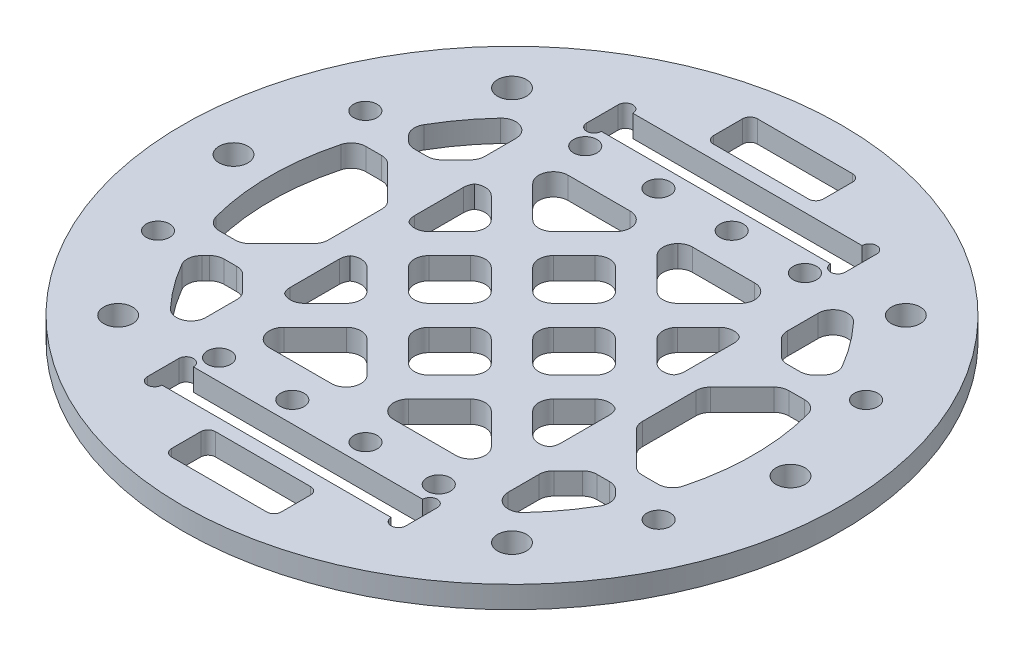
from build123d import *

# Parameters (mm, degrees)
SKETCH_1_R               = 45
EXTRUDE_1_DEPTH          = 3
CUT_EXTRUDE_1_DEPTH      = 64.7102817447859
CUT_EXTRUDE_1_DEPTH_BACK = 64.7102817447859
SKETCH_2_R               = 1.6000000000000019
SKETCH_2_R_2             = 1.6
SKETCH_3_R               = 1.5999999999999979
CUT_EXTRUDE_2_DEPTH      = 64.7102817447859
PATTERN_CIRCULAR_1_COUNT = 8
SKETCH_5_R               = 1.9749999999999976
CUT_EXTRUDE_3_DEPTH      = 64.7102817447859
PATTERN_CIRCULAR_2_COUNT = 8
CUT_EXTRUDE_4_DEPTH      = 64.7102817447859
CUT_EXTRUDE_4_DEPTH_BACK = 64.7102817447859
SKETCH_6_R               = 1.0000000000000018
CUT_EXTRUDE_5_DEPTH      = 64.7102817447859
CUT_EXTRUDE_5_DEPTH_BACK = 64.7102817447859
CUT_EXTRUDE_6_DEPTH      = 64.7102817447859
CUT_EXTRUDE_6_DEPTH_BACK = 64.7102817447859
FILLET_1_R               = 2
CUT_EXTRUDE_7_DEPTH      = 64.7102817447859
CUT_EXTRUDE_7_DEPTH_BACK = 64.7102817447859
FILLET_2_R               = 1


with BuildPart() as part:
    # 草图1 → 凸台-拉伸1 (new body)
    with BuildSketch(Plane(origin=(0, 0, 0), x_dir=(1, 0, 0), z_dir=(0, 1, 0))):
        with Locations(Location((0, 0, 0), (0, 0, 270))):
            Circle(SKETCH_1_R)
    extrude(amount=EXTRUDE_1_DEPTH)

    # 草图2 → 切除-拉伸1 (cut, two sides: drawn at the far end of the back side and taken through both)
    with BuildSketch(Plane(origin=(0, 3, 0), x_dir=(1, 0, 0), z_dir=(0, 1, 0)).offset(-CUT_EXTRUDE_1_DEPTH_BACK)):
        with Locations(Location((-15, 24.99999999999999, 0), (0, 0, 270))):
            Circle(SKETCH_2_R)
        with Locations(Location((-5.000000000000002, 24.999999999999993, 0), (0, 0, 270))):
            Circle(SKETCH_2_R_2)
        with Locations(Location((4.9999999999999964, 24.999999999999996, 0), (0, 0, 270))):
            Circle(SKETCH_2_R_2)
        with Locations(Location((14.999999999999993, 24.999999999999993, 0), (0, 0, 270))):
            Circle(SKETCH_2_R)
        with Locations(Location((14.999999999999993, -24.999999999999993, 0), (0, 0, 270))):
            Circle(SKETCH_2_R)
        with Locations(Location((4.9999999999999964, -24.999999999999996, 0), (0, 0, 270))):
            Circle(SKETCH_2_R_2)
        with Locations(Location((-5.000000000000002, -24.999999999999993, 0), (0, 0, 270))):
            Circle(SKETCH_2_R_2)
        with Locations(Location((-15, -24.99999999999999, 0), (0, 0, 270))):
            Circle(SKETCH_2_R)
        Polygon((-17.64999999999998, 32.15), (-17.649999999999995, 27.850000000000005), (17.65000000000001, 27.849999999999998), (17.65000000000002, 32.14999999999999), align=None)
        Polygon((-17.649999999999988, -32.15), (-17.650000000000006, -27.850000000000005), (17.65, -27.850000000000005), (17.65000000000002, -32.15), align=None)
    extrude(amount=CUT_EXTRUDE_1_DEPTH + CUT_EXTRUDE_1_DEPTH_BACK, mode=Mode.SUBTRACT)

    # 草图3 → 切除-拉伸2 (cut, symmetric)
    with BuildSketch(Plane(origin=(0, 3, 0), x_dir=(1, 0, 0), z_dir=(0, 1, 0))):
        with Locations(Location((34.1835427029176, 14.159286997508344, 0), (0, 0, 270))):
            Circle(SKETCH_3_R)
    cut_extrude_2 = extrude(amount=CUT_EXTRUDE_2_DEPTH, both=True, mode=Mode.SUBTRACT)

    # 阵列(圆周)1: 切除-拉伸2 ×8 about axis, 4 skipped
    pattern_circular_1_axis = Axis((0, 3, 0), (0, 1, 0))
    add([cut_extrude_2.rotate(pattern_circular_1_axis, i * 360 / PATTERN_CIRCULAR_1_COUNT) for i in range(1, PATTERN_CIRCULAR_1_COUNT) if i not in (1, 2, 5, 6)], mode=Mode.SUBTRACT)

    # 草图5 → 切除-拉伸3 (cut, symmetric)
    with BuildSketch(Plane(origin=(0, 3, 0), x_dir=(1, 0, 0), z_dir=(0, 1, 0))):
        with Locations(Location((38.025000000000006, -2.6553e-13, 0), (0, 0, 270))):
            Circle(SKETCH_5_R)
    cut_extrude_3 = extrude(amount=CUT_EXTRUDE_3_DEPTH, both=True, mode=Mode.SUBTRACT)

    # 阵列(圆周)2: 切除-拉伸3 ×8 about axis
    pattern_circular_2_axis = Axis((6e-17, 0, 3.334e-14), (0, 1, 0))
    for i in range(1, PATTERN_CIRCULAR_2_COUNT):
        add(cut_extrude_3.rotate(pattern_circular_2_axis, i * 360 / PATTERN_CIRCULAR_2_COUNT), mode=Mode.SUBTRACT)

    # 草图6 → 切除-拉伸4 (cut, two sides: drawn at the far end of the back side and taken through both)
    with BuildSketch(Plane(origin=(0, 3, 0), x_dir=(1, 0, 0), z_dir=(0, 1, 0)).offset(-CUT_EXTRUDE_4_DEPTH_BACK)):
        with Locations((-16.649999999999995, 27.850000000000005)):
            Circle(SKETCH_6_R)
        with Locations((-16.64999999999998, 32.15)):
            Circle(SKETCH_6_R)
        with Locations((16.65000000000002, 32.14999999999999)):
            Circle(SKETCH_6_R)
        with Locations((16.65000000000001, 27.850000000000005)):
            Circle(SKETCH_6_R)
        with Locations((16.65000000000002, -27.850000000000005)):
            Circle(SKETCH_6_R)
        with Locations((16.650000000000023, -32.15)):
            Circle(SKETCH_6_R)
        with Locations((-16.650000000000006, -27.850000000000005)):
            Circle(SKETCH_6_R)
        with Locations((-16.650000000000006, -32.15)):
            Circle(SKETCH_6_R)
    extrude(amount=CUT_EXTRUDE_4_DEPTH + CUT_EXTRUDE_4_DEPTH_BACK, mode=Mode.SUBTRACT)

    # 草图7 → 切除-拉伸5 (cut, two sides: drawn at the far end of the back side and taken through both)
    with BuildSketch(Plane(origin=(0, 3, 0), x_dir=(1, 0, 0), z_dir=(0, 1, 0)).offset(-CUT_EXTRUDE_5_DEPTH_BACK)):
        with BuildLine():
            Line((-21.44837043366389, 4.4778076851867485), (-26.970562748477143, 10.000000000000004))
            Line((-26.970562748477143, 10.000000000000004), (-31.448370433663893, 10.000000000000004))
            ThreePointArc((-31.448370391314782, 9.999999986533782), (-33, 4.04e-15), (-31.44837039131479, -9.99999998653376))
            Line((-31.448370433663893, -9.999999999999996), (-26.970562748476787, -9.999999999999996))
            Line((-26.970562748476787, -9.999999999999995), (-21.44837043366389, -4.477807685187097))
            Line((-21.44837043366389, -4.4778076851871), (-21.44837043366389, 4.477807685186752))
        make_face()
        with BuildLine():
            Line((26.970562748477136, 10.000000000000007), (21.448370433663868, 4.47780768518674))
            Line((21.448370433663868, 4.47780768518674), (21.448370433663868, -4.477807685187084))
            Line((21.448370433663875, -4.477807685187091), (26.970562748476787, -10.000000000000004))
            Line((26.970562748476784, -10), (31.44837043366387, -10))
            ThreePointArc((31.448370391314786, -9.999999986533775), (33, 3.55e-15), (31.44837039131479, 9.99999998653378))
            Line((31.44837043366387, 10.000000000000002), (26.970562748477132, 10.000000000000004))
        make_face()
    extrude(amount=CUT_EXTRUDE_5_DEPTH + CUT_EXTRUDE_5_DEPTH_BACK, mode=Mode.SUBTRACT)

    # 草图7<3> → 切除-拉伸6 (cut, two sides: drawn at the far end of the back side and taken through both)
    with BuildSketch(Plane(origin=(0, 3, 0), x_dir=(1, 0, 0), z_dir=(0, 1, 0)).offset(-CUT_EXTRUDE_6_DEPTH_BACK)):
        Polygon((-3.429437251523204, 20.399999999999988), (-17.571572875253793, 20.399999999999988), (-8.48528137423846, 11.313708498984653), (-1.4142135623731207, 18.3847763108499), align=None)
        Polygon((-16.970562748480017, 2.8284271247432065), (-11.313708498984662, 8.485281374238488), (-16.970562748477203, 14.14213562373103), (-18.44837043366389, 12.664327938544487), (-18.448370433663893, 4.306234809927718), align=None)
        Polygon((17.571572875253793, 20.399999999999988), (3.429437251523197, 20.399999999999988), (1.41421356237327, 18.38477631085006), (8.485281374238536, 11.313708498984736), align=None)
        Polygon((-3.55e-15, 14.142135623731296), (-5.656854249492522, 8.485281374238713), (0, 2.8284271247461916), (5.656854249492495, 8.485281374238689), align=None)
        Polygon((-2.828427124746181, 7.11e-15), (-8.485281374238685, 5.656854249492511), (-14.142135623734568, -3.43192e-12), (-8.485281374243293, -5.656854249497091), align=None)
        with BuildLine():
            Line((-20.649999999999995, 16.11955262170047), (-20.649999999999995, 17.82157287525382))
            Line((-20.649999999999995, 17.82157287525382), (-20.649999999999988, 25.740580801528235))
            ThreePointArc((-20.649999999999928, 25.740580801528218), (-25.532625064446698, 20.906579283048394), (-29.30842376980283, 15.16628814607109))
            Line((-29.30842376980275, 15.166288146071132), (-27.142135623732543, 13.00000000000001))
            Line((-27.142135623732543, 13.000000000000005), (-23.769552621700456, 13.000000000000005))
            Line((-23.769552621700456, 13.000000000000002), (-20.649999999999995, 16.11955262170047))
        make_face()
        Polygon((8.485281374238651, 5.656854249492474), (2.828427124746181, 3.55e-15), (8.485281374248604, -5.656854249502413), (14.14213562373895, -7.92788e-12), align=None)
        Polygon((16.9705627484772, 14.142135623731022), (11.313708498984717, 8.48528137423854), (16.970562748484017, 2.828427124739207), (18.44837043366387, 4.30623480992014), (18.44837043366387, 12.664327938544487), align=None)
        Polygon((5.656854249503461, -8.485281374249634), (1.066e-14, -2.8284271247461845), (-5.6568542494976946, -8.485281374243872), (6.62936e-12, -14.142135623750583), align=None)
        Polygon((-11.313708498984692, -8.485281374238491), (-16.970562748477114, -2.8284271247460104), (-18.448370433663893, -4.306234809932805), (-18.448370433663893, -12.664327938544487), (-16.97056274847721, -14.142135623731022), align=None)
        with BuildLine():
            ThreePointArc((29.3084237698043, 15.166288146068254), (25.53262506444785, 20.906579283046984), (20.65000000000026, 25.740580801527944))
            Line((20.65000000000002, 25.740580801527866), (20.65000000000002, 17.821572875253842))
            Line((20.65000000000002, 17.821572875253842), (20.65000000000002, 16.119552621700446))
            Line((20.65000000000002, 16.119552621700446), (23.769552621700456, 13.000000000000002))
            Line((23.769552621700456, 13.000000000000002), (27.142135623737385, 13.000000000000002))
            Line((27.142135623737385, 13.000000000000005), (29.308423769804147, 15.166288146068348))
        make_face()
        Polygon((16.97056274847706, -2.8284271247460886), (11.313708498984695, -8.485281374238504), (16.970562748477207, -14.142135623731019), (18.448370433663868, -12.664327938544485), (18.44837043366387, -4.3062348099329295), align=None)
        Polygon((-1.4142135623730816, -18.384776310850203), (-8.485281374238523, -11.31370849898469), (-17.57157287525382, -20.4), (-3.4294372515228666, -20.399999999999995), align=None)
        Polygon((17.57157287525382, -20.399999999999995), (8.485281374238529, -11.313708498984703), (1.414213562373075, -18.384776310850214), (3.429437251522856, -20.399999999999995), align=None)
        with BuildLine():
            Line((-23.769552621700456, -12.999999999999998), (-27.142135623730987, -13))
            Line((-27.142135623730987, -13), (-29.308423769802527, -15.166288146071564))
            ThreePointArc((-29.308423769802612, -15.166288146071512), (-25.53262506444661, -20.9065792830485), (-20.65000000000006, -25.74058080152811))
            Line((-20.650000000000034, -25.740580801528093), (-20.64999999999999, -17.821572875253803))
            Line((-20.649999999999988, -17.821572875253803), (-20.649999999999988, -16.11955262170048))
            Line((-20.649999999999988, -16.11955262170048), (-23.769552621700456, -13.000000000000002))
        make_face()
        with BuildLine():
            Line((20.65000000000002, -17.821572875253832), (20.650000000000055, -25.740580801528083))
            ThreePointArc((20.650000000000073, -25.7405808015281), (25.532625064446584, -20.906579283048536), (29.308423769802573, -15.166288146071587))
            Line((29.308423769802403, -15.166288146071674), (27.142135623730763, -12.999999999999995))
            Line((27.142135623730766, -13.000000000000002), (23.769552621700456, -13.000000000000002))
            Line((23.769552621700456, -13.000000000000002), (20.65000000000002, -16.119552621700446))
            Line((20.65000000000002, -16.119552621700446), (20.65000000000002, -17.821572875253832))
        make_face()
    extrude(amount=CUT_EXTRUDE_6_DEPTH + CUT_EXTRUDE_6_DEPTH_BACK, mode=Mode.SUBTRACT)

    # 圆角1
    # the kernel refuses this fillet: 2 mm, written as the material it adds along each edge
    with BuildSketch(Plane(origin=(-8.485281374243288, 3, 5.656854249497091), x_dir=(-0.7071067811863999, 0, -0.7071067811866952), z_dir=(0, -1, 0))) as fillet_1_piece_1:
        with BuildLine():
            CenterArc((FILLET_1_R, FILLET_1_R), FILLET_1_R, 179.9999999999879, 90.00000000001216)
            Line((4.1756e-13, FILLET_1_R), (0, 0))
            Line((0, 0), (FILLET_1_R, -3e-17))
        make_face()
    extrude(amount=3)
    with BuildSketch(Plane(origin=(-14.14213562373457, 3, 3.43015e-12), x_dir=(0.7071067811865441, 0, -0.7071067811865508), z_dir=(0, -1, 0))) as fillet_1_piece_2:
        with BuildLine():
            CenterArc((FILLET_1_R, FILLET_1_R), FILLET_1_R, 180.0000000000123, 89.99999999998761)
            Line((-4.3256e-13, FILLET_1_R), (0, 0))
            Line((0, 0), (FILLET_1_R, 0))
        make_face()
    extrude(amount=3)
    with BuildSketch(Plane(origin=(-8.485281374238687, 0, -5.656854249492511), x_dir=(0.707106781186548, 0, 0.7071067811865471), z_dir=(0, 1, 0))) as fillet_1_piece_3:
        with BuildLine():
            CenterArc((FILLET_1_R, -FILLET_1_R), FILLET_1_R, 89.99999999999997, 90.00000000000045)
            Line((9.47e-15, -FILLET_1_R), (0, 0))
            Line((0, 0), (FILLET_1_R, -8e-17))
        make_face()
    extrude(amount=3)
    with BuildSketch(Plane(origin=(-2.8284271247461827, 0, -8.88e-15), x_dir=(-0.7071067811865476, 0, -0.7071067811865475), z_dir=(0, 1, 0))) as fillet_1_piece_4:
        with BuildLine():
            CenterArc((FILLET_1_R, FILLET_1_R), FILLET_1_R, 180.00000000000006, 89.99999999999994)
            Line((-4.2e-16, FILLET_1_R), (0, 0))
            Line((0, 0), (FILLET_1_R, -4e-17))
        make_face()
    extrude(amount=3)
    with BuildSketch(Plane(origin=(-16.970562748477203, 3, -14.14213562373103), x_dir=(0.7071067811865476, 0, 0.7071067811865476), z_dir=(0, -1, 0))) as fillet_1_piece_5:
        with BuildLine():
            CenterArc((FILLET_1_R, FILLET_1_R), FILLET_1_R, 180.0000000000028, 89.99999999999716)
            Line((-9.803e-14, FILLET_1_R), (0, 0))
            Line((0, 0), (FILLET_1_R, -1e-17))
        make_face()
    extrude(amount=3)
    with BuildSketch(Plane(origin=(-11.313708498984662, 0, -8.485281374238488), x_dir=(-0.7071067811865521, 0, 0.7071067811865432), z_dir=(0, 1, 0))) as fillet_1_piece_6:
        with BuildLine():
            CenterArc((FILLET_1_R, -FILLET_1_R), FILLET_1_R, 89.99999999999996, 90.0000000000004)
            Line((1.256e-14, -FILLET_1_R), (0, 0))
            Line((0, 0), (FILLET_1_R, -6e-17))
        make_face()
    extrude(amount=3)
    with BuildSketch(Plane(origin=(-16.97056274848002, 0, -2.8284271247432087), x_dir=(0.7071067811865535, 0, -0.7071067811865417), z_dir=(0, 1, 0))) as fillet_1_piece_7:
        with BuildLine():
            CenterArc((FILLET_1_R, FILLET_1_R), FILLET_1_R, 179.99999999998835, 90.00000000001177)
            Line((4.0452e-13, FILLET_1_R), (0, 0))
            Line((0, 0), (FILLET_1_R, 6e-17))
        make_face()
    extrude(amount=3)
    with BuildSketch(Plane(origin=(-18.448370433663897, 3, -4.306234809927716), x_dir=(4.29e-15, 0, -1), z_dir=(0, -1, 0))) as fillet_1_piece_8:
        with BuildLine():
            CenterArc((FILLET_1_R * 0.414213562373, FILLET_1_R), FILLET_1_R, 225.00000000001185, 44.99999999998789)
            Line((-FILLET_1_R * 0.292893218813, FILLET_1_R * 0.292893218813), (0, 0))
            Line((0, 0), (FILLET_1_R * 0.414213562373, 0))
        make_face()
    extrude(amount=3)
    with BuildSketch(Plane(origin=(-18.44837043366389, 3, -12.664327938544487), x_dir=(0.7071067811865819, 0, -0.7071067811865133), z_dir=(0, -1, 0))) as fillet_1_piece_9:
        with BuildLine():
            CenterArc((FILLET_1_R * 0.414213562373, FILLET_1_R), FILLET_1_R, 224.99999999999721, 45.00000000000284)
            Line((-FILLET_1_R * 0.292893218813, FILLET_1_R * 0.292893218813), (0, 0))
            Line((0, 0), (FILLET_1_R * 0.414213562373, 0))
        make_face()
    extrude(amount=3)
    with BuildSketch(Plane(origin=(0, 0, -2.8284271247461916), x_dir=(-0.7071067811865474, 0, -0.7071067811865478), z_dir=(0, 1, 0))) as fillet_1_piece_10:
        with BuildLine():
            CenterArc((FILLET_1_R, -FILLET_1_R), FILLET_1_R, 90.00000000000001, 90)
            Line((7e-16, -FILLET_1_R), (0, 0))
            Line((0, 0), (FILLET_1_R, -7e-17))
        make_face()
    extrude(amount=3)
    with BuildSketch(Plane(origin=(-5.656854249492521, 0, -8.485281374238713), x_dir=(0.7071067811865476, 0, 0.7071067811865476), z_dir=(0, 1, 0))) as fillet_1_piece_11:
        with BuildLine():
            CenterArc((FILLET_1_R, FILLET_1_R), FILLET_1_R, 180.00000000000037, 89.9999999999996)
            Line((-1.009e-14, FILLET_1_R), (0, 0))
            Line((0, 0), (FILLET_1_R, 1e-17))
        make_face()
    extrude(amount=3)
    with BuildSketch(Plane(origin=(-1.78e-15, 3, -14.142135623731296), x_dir=(0.7071067811865411, 0, 0.707106781186554), z_dir=(0, -1, 0))) as fillet_1_piece_12:
        with BuildLine():
            CenterArc((FILLET_1_R, FILLET_1_R), FILLET_1_R, 179.9999999999991, 90.00000000000097)
            Line((2.737e-14, FILLET_1_R), (0, 0))
            Line((0, 0), (FILLET_1_R, -1e-16))
        make_face()
    extrude(amount=3)
    with BuildSketch(Plane(origin=(5.656854249492495, 3, -8.485281374238689), x_dir=(-0.7071067811865474, 0, 0.7071067811865478), z_dir=(0, -1, 0))) as fillet_1_piece_13:
        with BuildLine():
            CenterArc((FILLET_1_R, FILLET_1_R), FILLET_1_R, 180.00000000000057, 89.99999999999943)
            Line((-2.068e-14, FILLET_1_R), (0, 0))
            Line((0, 0), (FILLET_1_R, -2e-17))
        make_face()
    extrude(amount=3)
    with BuildSketch(Plane(origin=(-17.57157287525382, 0, 20.4), x_dir=(1, 0, -7.4e-16), z_dir=(0, 1, 0))) as fillet_1_piece_14:
        with BuildLine():
            CenterArc((FILLET_1_R * 2.41421356237, FILLET_1_R), FILLET_1_R, 134.99999999999997, 134.99999999999997)
            Line((FILLET_1_R * 1.70710678119, FILLET_1_R * 1.70710678119), (0, 0))
            Line((0, 0), (FILLET_1_R * 2.41421356237, 0))
        make_face()
    extrude(amount=3)
    with BuildSketch(Plane(origin=(-8.485281374238522, 3, 11.313708498984695), x_dir=(0.7071067811865446, 0, 0.7071067811865503), z_dir=(0, -1, 0))) as fillet_1_piece_15:
        with BuildLine():
            CenterArc((FILLET_1_R, FILLET_1_R), FILLET_1_R, 179.9999999999997, 90.00000000000034)
            Line((8.23e-15, FILLET_1_R), (0, 0))
            Line((0, 0), (FILLET_1_R, 5e-17))
        make_face()
    extrude(amount=3)
    with BuildSketch(Plane(origin=(-18.448370433663893, 0, 4.306234809932805), x_dir=(0.7071067811865437, 0, -0.7071067811865512), z_dir=(0, 1, 0))) as fillet_1_piece_16:
        with BuildLine():
            CenterArc((FILLET_1_R * 0.414213562373, -FILLET_1_R), FILLET_1_R, 90, 44.99999999999969)
            Line((-FILLET_1_R * 0.292893218813, -FILLET_1_R * 0.292893218813), (0, 0))
            Line((0, 0), (FILLET_1_R * 0.414213562373, -1e-17))
        make_face()
    extrude(amount=3)
    with BuildSketch(Plane(origin=(-16.970562748477114, 0, 2.8284271247460113), x_dir=(-0.7071067811865436, 0, 0.7071067811865516), z_dir=(0, 1, 0))) as fillet_1_piece_17:
        with BuildLine():
            CenterArc((FILLET_1_R, FILLET_1_R), FILLET_1_R, 179.99999999999943, 90.00000000000057)
            Line((2.318e-14, FILLET_1_R), (0, 0))
            Line((0, 0), (FILLET_1_R, -4e-17))
        make_face()
    extrude(amount=3)
    with BuildSketch(Plane(origin=(-11.313708498984688, 3, 8.485281374238493), x_dir=(-0.7071067811865462, 0, 0.7071067811865489), z_dir=(0, -1, 0))) as fillet_1_piece_18:
        with BuildLine():
            CenterArc((FILLET_1_R, FILLET_1_R), FILLET_1_R, 180.00000000000028, 89.99999999999977)
            Line((-1.256e-14, FILLET_1_R), (0, 0))
            Line((0, 0), (FILLET_1_R, 5e-17))
        make_face()
    extrude(amount=3)
    with BuildSketch(Plane(origin=(-16.970562748477207, 3, 14.14213562373102), x_dir=(-0.707106781186584, 0, -0.7071067811865112), z_dir=(0, -1, 0))) as fillet_1_piece_19:
        with BuildLine():
            CenterArc((FILLET_1_R, FILLET_1_R), FILLET_1_R, 180.0000000000027, 89.99999999999739)
            Line((-1.0047e-13, FILLET_1_R), (0, 0))
            Line((0, 0), (FILLET_1_R, 3e-17))
        make_face()
    extrude(amount=3)
    with BuildSketch(Plane(origin=(-18.44837043366389, 3, 12.664327938544487), x_dir=(-4.29e-15, 0, -1), z_dir=(0, -1, 0))) as fillet_1_piece_20:
        with BuildLine():
            CenterArc((FILLET_1_R * 0.414213562373, FILLET_1_R), FILLET_1_R, 224.99999999999736, 45.0000000000029)
            Line((-FILLET_1_R * 0.292893218813, FILLET_1_R * 0.292893218813), (0, 0))
            Line((0, 0), (FILLET_1_R * 0.414213562373, 0))
        make_face()
    extrude(amount=3)
    with BuildSketch(Plane(origin=(16.970562748477207, 0, 14.142135623731017), x_dir=(-0.7071067811865479, 0, -0.707106781186547), z_dir=(0, 1, 0))) as fillet_1_piece_21:
        with BuildLine():
            CenterArc((FILLET_1_R, -FILLET_1_R), FILLET_1_R, 89.99999999999993, 89.99999999999751)
            Line((-9.298e-14, -FILLET_1_R), (0, 0))
            Line((0, 0), (FILLET_1_R, -1e-17))
        make_face()
    extrude(amount=3)
    with BuildSketch(Plane(origin=(11.313708498984695, 0, 8.485281374238504), x_dir=(0.7071067811865471, 0, 0.707106781186548), z_dir=(0, 1, 0))) as fillet_1_piece_22:
        with BuildLine():
            CenterArc((FILLET_1_R, FILLET_1_R), FILLET_1_R, 180.00000000000026, 89.99999999999972)
            Line((-1.071e-14, FILLET_1_R), (0, 0))
            Line((0, 0), (FILLET_1_R, 5e-17))
        make_face()
    extrude(amount=3)
    with BuildSketch(Plane(origin=(16.970562748477057, 3, 2.8284271247460895), x_dir=(0.7071067811865401, 0, 0.7071067811865552), z_dir=(0, -1, 0))) as fillet_1_piece_23:
        with BuildLine():
            CenterArc((FILLET_1_R, FILLET_1_R), FILLET_1_R, 179.99999999999915, 90.00000000000085)
            Line((2.769e-14, FILLET_1_R), (0, 0))
            Line((0, 0), (FILLET_1_R, -4e-17))
        make_face()
    extrude(amount=3)
    with BuildSketch(Plane(origin=(18.448370433663868, 3, 4.3062348099329295), x_dir=(4.29e-15, 0, 1), z_dir=(0, -1, 0))) as fillet_1_piece_24:
        with BuildLine():
            CenterArc((FILLET_1_R * 0.414213562373, FILLET_1_R), FILLET_1_R, 225.00000000000074, 44.99999999999949)
            Line((-FILLET_1_R * 0.292893218813, FILLET_1_R * 0.292893218813), (0, 0))
            Line((0, 0), (FILLET_1_R * 0.414213562373, 0))
        make_face()
    extrude(amount=3)
    with BuildSketch(Plane(origin=(18.448370433663868, 3, 12.664327938544485), x_dir=(-0.7071067811865797, 0, 0.7071067811865154), z_dir=(0, -1, 0))) as fillet_1_piece_25:
        with BuildLine():
            CenterArc((FILLET_1_R * 0.414213562373, FILLET_1_R), FILLET_1_R, 224.99999999999744, 45.0000000000025)
            Line((-FILLET_1_R * 0.292893218813, FILLET_1_R * 0.292893218813), (0, 0))
            Line((0, 0), (FILLET_1_R * 0.414213562373, 3e-17))
        make_face()
    extrude(amount=3)
    with BuildSketch(Plane(origin=(-20.649999999999995, 0, -16.11955262170047), x_dir=(0, 0, -1), z_dir=(0, 1, 0))) as fillet_1_piece_26:
        with BuildLine():
            CenterArc((FILLET_1_R * 0.414213562373, FILLET_1_R), FILLET_1_R, 225.00000000000003, 45)
            Line((-FILLET_1_R * 0.292893218813, FILLET_1_R * 0.292893218813), (0, 0))
            Line((0, 0), (FILLET_1_R * 0.414213562373, 0))
        make_face()
    extrude(amount=3)
    with BuildSketch(Plane(origin=(-23.769552621700456, 3, -13.000000000000004), x_dir=(-1, 0, -2.14e-15), z_dir=(0, -1, 0))) as fillet_1_piece_27:
        with BuildLine():
            CenterArc((FILLET_1_R * 0.414213562373, FILLET_1_R), FILLET_1_R, 224.9999999999999, 45)
            Line((-FILLET_1_R * 0.292893218813, FILLET_1_R * 0.292893218813), (0, 0))
            Line((0, 0), (FILLET_1_R * 0.414213562373, 0))
        make_face()
    extrude(amount=3)
    with BuildSketch(Plane(origin=(-27.142135623732543, 3, -13.000000000000007), x_dir=(-0.7071067811863953, 0, -0.7071067811866998), z_dir=(0, -1, 0))) as fillet_1_piece_28:
        with BuildLine():
            CenterArc((FILLET_1_R * 0.414213562373, FILLET_1_R), FILLET_1_R, 224.99999999998775, 45.000000000011994)
            Line((-FILLET_1_R * 0.292893218813, FILLET_1_R * 0.292893218814), (0, 0))
            Line((0, 0), (FILLET_1_R * 0.414213562373, -4e-17))
        make_face()
    extrude(amount=3)
    with BuildSketch(Plane(origin=(-29.308423769802793, 3, -15.16628814607111), x_dir=(0.48026215463850636, 0, -0.8771249984021545), z_dir=(0, -1, 0))) as fillet_1_piece_29:
        with BuildLine():
            CenterArc((1.499144306143534, 1.999451234858091), FILLET_1_R, 196.2974748554541, 75.04475168334295)
            Line((-0.4204910150774538, 1.438202418805179), (0, 0))
            ThreePointArc((0, 0), (0.7729962828552733, -0.0090546248415106), (1.5459925657105555, 8e-17))
        make_face()
    extrude(amount=3)
    with BuildSketch(Plane(origin=(-31.44837041248934, 0, 9.999999993266874), x_dir=(-0.2806243940298316, 0, -0.9598176647027236), z_dir=(0, 1, 0))) as fillet_1_piece_30:
        with BuildLine():
            CenterArc((1.4991443216942395, -1.9994512355412468), FILLET_1_R, 88.65777429671002, 75.04475168335676)
            Line((-0.4204910077112095, -1.4382024474815904), (0, 0))
            ThreePointArc((0, 0), (0.7729962759221107, 0.00905461356940789), (1.545992552104564, 3e-17))
        make_face()
    extrude(amount=3)
    with BuildSketch(Plane(origin=(-31.448370412489332, 0, -9.999999993266892), x_dir=(1.0, 0, -4.493497901417946e-09), z_dir=(0, 1, 0))) as fillet_1_piece_31:
        with BuildLine():
            CenterArc((1.49841213975847, -2), FILLET_1_R, 89.99999974254155, 75.04475168335657)
            ThreePointArc((-0.4338432297767472, -1.4838709590593469), (-0.2256123928914084, -0.7393945339195913), (0, 0))
            Line((0, 0), (1.4984121487454658, 0))
        make_face()
    extrude(amount=3)
    with BuildSketch(Plane(origin=(31.448370412489332, 0, -9.99999999326689), x_dir=(-1.0, 0, -4.493497901417989e-09), z_dir=(0, 1, 0))) as fillet_1_piece_32:
        with BuildLine():
            CenterArc((1.4984121397584558, 2), FILLET_1_R, 194.95524857410172, 75.04475168335671)
            ThreePointArc((-0.433843229776765, 1.4838709590593522), (-0.2256123928914226, 0.7393945339195931), (0, 0))
            Line((0, 0), (1.4984121487454516, 0))
        make_face()
    extrude(amount=3)
    with BuildSketch(Plane(origin=(31.448370412489332, 3, 9.999999993266888), x_dir=(0.28062439402983425, 0, -0.9598176647027227), z_dir=(0, -1, 0))) as fillet_1_piece_33:
        with BuildLine():
            CenterArc((1.4991443216942513, -1.9994512355412484), FILLET_1_R, 88.65777429670968, 75.04475168335676)
            Line((-0.4204910077111942, -1.4382024474815798), (0, 0))
            ThreePointArc((0, 0), (0.7729962759221258, 0.00905461356941978), (1.5459925521045874, -2e-17))
        make_face()
    extrude(amount=3)
    with BuildSketch(Plane(origin=(17.57157287525382, 0, 20.399999999999995), x_dir=(-1, 0, 0), z_dir=(0, 1, 0))) as fillet_1_piece_34:
        with BuildLine():
            CenterArc((FILLET_1_R * 2.41421356237, -FILLET_1_R), FILLET_1_R, 90, 135.00000000000003)
            Line((FILLET_1_R * 1.70710678119, -FILLET_1_R * 1.70710678119), (0, 0))
            Line((0, 0), (FILLET_1_R * 2.41421356237, 0))
        make_face()
    extrude(amount=3)
    with BuildSketch(Plane(origin=(8.485281374238527, 3, 11.3137084989847), x_dir=(0.7071067811865477, 0, 0.7071067811865477), z_dir=(0, -1, 0))) as fillet_1_piece_35:
        with BuildLine():
            CenterArc((FILLET_1_R, FILLET_1_R), FILLET_1_R, 179.99999999999974, 90.00000000000023)
            Line((6.3e-15, FILLET_1_R), (0, 0))
            Line((0, 0), (FILLET_1_R, -5e-17))
        make_face()
    extrude(amount=3)
    with BuildSketch(Plane(origin=(5.656854249503457, 3, 8.485281374249631), x_dir=(-0.7071067811862916, 0, 0.7071067811868036), z_dir=(0, -1, 0))) as fillet_1_piece_36:
        with BuildLine():
            CenterArc((FILLET_1_R, FILLET_1_R), FILLET_1_R, 180.00000000002092, 89.99999999997891)
            Line((-7.266e-13, FILLET_1_R), (0, 0))
            Line((0, 0), (FILLET_1_R, 0))
        make_face()
    extrude(amount=3)
    with BuildSketch(Plane(origin=(6.62974e-12, 0, 14.142135623750583), x_dir=(-0.7071067811863985, 0, -0.7071067811866967), z_dir=(0, 1, 0))) as fillet_1_piece_37:
        with BuildLine():
            CenterArc((FILLET_1_R, -FILLET_1_R), FILLET_1_R, 90.00000000000001, 90.00000000003303)
            Line((1.15308e-12, -FILLET_1_R), (0, 0))
            Line((0, 0), (FILLET_1_R, -6e-17))
        make_face()
    extrude(amount=3)
    with BuildSketch(Plane(origin=(-5.656854249497698, 0, 8.48528137424387), x_dir=(0.7071067811863981, 0, 0.707106781186697), z_dir=(0, 1, 0))) as fillet_1_piece_38:
        with BuildLine():
            CenterArc((FILLET_1_R, FILLET_1_R), FILLET_1_R, 180.00000000001208, 89.99999999998795)
            Line((-4.2262e-13, FILLET_1_R), (0, 0))
            Line((0, 0), (FILLET_1_R, 1e-17))
        make_face()
    extrude(amount=3)
    with BuildSketch(Plane(origin=(7.11e-15, 3, 2.828427124746179), x_dir=(0.707106781186547, 0, 0.7071067811865479), z_dir=(0, -1, 0))) as fillet_1_piece_39:
        with BuildLine():
            CenterArc((FILLET_1_R, FILLET_1_R), FILLET_1_R, 180, 89.99999999999994)
            Line((-1.47e-15, FILLET_1_R), (0, 0))
            Line((0, 0), (FILLET_1_R, 1e-17))
        make_face()
    extrude(amount=3)
    with BuildSketch(Plane(origin=(20.65000000000002, 3, 16.119552621700446), x_dir=(0.7071067811865465, 0, -0.7071067811865486), z_dir=(0, -1, 0))) as fillet_1_piece_40:
        with BuildLine():
            CenterArc((FILLET_1_R * 0.414213562373, FILLET_1_R), FILLET_1_R, 224.99999999999977, 45.000000000000284)
            Line((-FILLET_1_R * 0.292893218813, FILLET_1_R * 0.292893218813), (0, 0))
            Line((0, 0), (FILLET_1_R * 0.414213562373, -1e-17))
        make_face()
    extrude(amount=3)
    with BuildSketch(Plane(origin=(23.769552621700456, 3, 13.000000000000002), x_dir=(1, 0, 0), z_dir=(0, -1, 0)), Plane(origin=(-26.970562748476787, 3, 9.999999999999996), x_dir=(-1, 0, 0), z_dir=(0, -1, 0))) as fillet_1_piece_41:
        with BuildLine():
            CenterArc((FILLET_1_R * 0.414213562373, FILLET_1_R), FILLET_1_R, 224.99999999999994, 45.00000000000006)
            Line((-FILLET_1_R * 0.292893218813, FILLET_1_R * 0.292893218813), (0, 0))
            Line((0, 0), (FILLET_1_R * 0.414213562373, 0))
        make_face()
    extrude(amount=3)
    with BuildSketch(Plane(origin=(27.142135623730766, 0, 12.999999999999998), x_dir=(0.7071067811865432, 0, 0.7071067811865518), z_dir=(0, 1, 0))) as fillet_1_piece_42:
        with BuildLine():
            CenterArc((FILLET_1_R * 0.414213562373, -FILLET_1_R), FILLET_1_R, 89.99999999999989, 45.00000000000057)
            Line((-FILLET_1_R * 0.292893218813, -FILLET_1_R * 0.292893218813), (0, 0))
            Line((0, 0), (FILLET_1_R * 0.414213562373, -1e-17))
        make_face()
    extrude(amount=3)
    with BuildSketch(Plane(origin=(29.30842376980249, 0, 15.16628814607163), x_dir=(-0.48026215463851096, 0, 0.877124998402152), z_dir=(0, 1, 0))) as fillet_1_piece_43:
        with BuildLine():
            CenterArc((1.4991443061439038, -1.9994512348580888), FILLET_1_R, 88.65777346120144, 75.04475168335644)
            Line((-0.4204910150772023, -1.4382024188055782), (0, 0))
            ThreePointArc((0, 0), (0.7729962828554874, 0.0090546248415306), (1.5459925657109772, 6e-17))
        make_face()
    extrude(amount=3)
    with BuildSketch(Plane(origin=(20.650000000000066, 0, 25.740580801528093), x_dir=(0.7332653110766536, 0, -0.6799426325592908), z_dir=(0, 1, 0))) as fillet_1_piece_44:
        with BuildLine():
            CenterArc((4.5773374061833865, 1.9948782030954904), FILLET_1_R, 137.16083968785634, 136.94050749824711)
            Line((3.11080678403007, 3.3547634682140615), (0, 0))
            ThreePointArc((0, 0), (2.3601896000633174, -0.08450964892437705), (4.720379200126623, 2.2e-16))
        make_face()
    extrude(amount=3)
    with BuildSketch(Plane(origin=(-27.142135623730987, 0, 13), x_dir=(-0.7071067811865432, 0, 0.7071067811865518), z_dir=(0, 1, 0))) as fillet_1_piece_45:
        with BuildLine():
            CenterArc((FILLET_1_R * 0.414213562373, FILLET_1_R), FILLET_1_R, 224.99999999999974, 45.00000000000023)
            Line((-FILLET_1_R * 0.292893218813, FILLET_1_R * 0.292893218813), (0, 0))
            Line((0, 0), (FILLET_1_R * 0.414213562373, -1e-17))
        make_face()
    extrude(amount=3)
    with BuildSketch(Plane(origin=(-23.769552621700456, 3, 13), x_dir=(0.7071067811865465, 0, 0.7071067811865486), z_dir=(0, -1, 0))) as fillet_1_piece_46:
        with BuildLine():
            CenterArc((FILLET_1_R * 0.414213562373, FILLET_1_R), FILLET_1_R, 224.9999999999999, 45.00000000000006)
            Line((-FILLET_1_R * 0.292893218813, FILLET_1_R * 0.292893218813), (0, 0))
            Line((0, 0), (FILLET_1_R * 0.414213562373, 0))
        make_face()
    extrude(amount=3)
    with BuildSketch(Plane(origin=(-20.649999999999988, 3, 16.11955262170048), x_dir=(0, 0, 1), z_dir=(0, -1, 0))) as fillet_1_piece_47:
        with BuildLine():
            CenterArc((FILLET_1_R * 0.414213562373, FILLET_1_R), FILLET_1_R, 224.9999999999999, 45.000000000000455)
            Line((-FILLET_1_R * 0.292893218813, FILLET_1_R * 0.292893218813), (0, 0))
            Line((0, 0), (FILLET_1_R * 0.414213562373, 0))
        make_face()
    extrude(amount=3)
    with BuildSketch(Plane(origin=(-20.65000000000005, 3, 25.740580801528104), x_dir=(-0.733265311076655, 0, -0.679942632559289), z_dir=(0, -1, 0))) as fillet_1_piece_48:
        with BuildLine():
            CenterArc((4.577337406183359, 1.9948782030954921), FILLET_1_R, 137.16083968785617, 136.94050749824737)
            Line((3.110806784030047, 3.3547634682140672), (0, 0))
            ThreePointArc((0, 0), (2.3601896000633045, -0.08450964892437464), (4.720379200126598, -6e-17))
        make_face()
    extrude(amount=3)
    with BuildSketch(Plane(origin=(-29.308423769802573, 0, 15.16628814607154), x_dir=(0.7071067811865664, 0, -0.7071067811865285), z_dir=(0, 1, 0))) as fillet_1_piece_49:
        with BuildLine():
            CenterArc((1.4984121232889123, -1.9999999999999996), FILLET_1_R, 90.00000000000186, 75.04475168335624)
            ThreePointArc((-0.43384324856554546, -1.483870967741983), (-0.22561241311586402, -0.7393945351349388), (0, 0))
            Line((0, 0), (1.4984121232888474, 7e-17))
        make_face()
    extrude(amount=3)
    with BuildSketch(Plane(origin=(8.485281374238536, 0, -11.313708498984735), x_dir=(0.7071067811865489, 0, -0.7071067811865462), z_dir=(0, 1, 0))) as fillet_1_piece_50:
        with BuildLine():
            CenterArc((FILLET_1_R, FILLET_1_R), FILLET_1_R, 179.99999999999986, 90.00000000000028)
            Line((2.42e-15, FILLET_1_R), (0, 0))
            Line((0, 0), (FILLET_1_R, -3e-17))
        make_face()
    extrude(amount=3)
    with BuildSketch(Plane(origin=(17.571572875253793, 0, -20.399999999999988), x_dir=(-0.7071067811865471, 0, 0.7071067811865478), z_dir=(0, 1, 0))) as fillet_1_piece_51:
        with BuildLine():
            CenterArc((FILLET_1_R * 2.41421356237, -FILLET_1_R), FILLET_1_R, 89.99999999999997, 135.00000000000006)
            Line((FILLET_1_R * 1.70710678119, -FILLET_1_R * 1.70710678119), (0, 0))
            Line((0, 0), (FILLET_1_R * 2.41421356237, 2e-16))
        make_face()
    extrude(amount=3)
    with BuildSketch(Plane(origin=(-8.485281374238461, 3, -11.313708498984653), x_dir=(-0.7071067811865476, 0, -0.7071067811865476), z_dir=(0, -1, 0))) as fillet_1_piece_52:
        with BuildLine():
            CenterArc((FILLET_1_R, FILLET_1_R), FILLET_1_R, 180.00000000000037, 89.99999999999966)
            Line((-1.454e-14, FILLET_1_R), (0, 0))
            Line((0, 0), (FILLET_1_R, -5e-17))
        make_face()
    extrude(amount=3)
    with BuildSketch(Plane(origin=(-17.571572875253793, 0, -20.399999999999988), x_dir=(1, 0, 0), z_dir=(0, 1, 0))) as fillet_1_piece_53:
        with BuildLine():
            CenterArc((FILLET_1_R * 2.41421356237, -FILLET_1_R), FILLET_1_R, 90, 135)
            Line((FILLET_1_R * 1.70710678119, -FILLET_1_R * 1.70710678119), (0, 0))
            Line((0, 0), (FILLET_1_R * 2.41421356237, 0))
        make_face()
    extrude(amount=3)
    with BuildSketch(Plane(origin=(14.142135623738948, 0, 7.92788e-12), x_dir=(-0.7071067811865408, 0, -0.7071067811865542), z_dir=(0, 1, 0))) as fillet_1_piece_54:
        with BuildLine():
            CenterArc((FILLET_1_R, FILLET_1_R), FILLET_1_R, 180.00000000002152, 89.99999999997851)
            Line((-7.4895e-13, FILLET_1_R), (0, 0))
            Line((0, 0), (FILLET_1_R, -4e-17))
        make_face()
    extrude(amount=3)
    with BuildSketch(Plane(origin=(8.485281374248602, 3, 5.656854249502412), x_dir=(-0.7071067811865474, 0, -0.7071067811865478), z_dir=(0, -1, 0))) as fillet_1_piece_55:
        with BuildLine():
            CenterArc((FILLET_1_R, FILLET_1_R), FILLET_1_R, 179.99999999997902, 90.00000000002098)
            Line((7.2915e-13, FILLET_1_R), (0, 0))
            Line((0, 0), (FILLET_1_R, -4e-17))
        make_face()
    extrude(amount=3)
    with BuildSketch(Plane(origin=(2.8284271247461827, 3, -5.33e-15), x_dir=(0.7071067811865476, 0, -0.7071067811865476), z_dir=(0, -1, 0))) as fillet_1_piece_56:
        with BuildLine():
            CenterArc((FILLET_1_R, FILLET_1_R), FILLET_1_R, 180, 90)
            Line((-1.4e-16, FILLET_1_R), (0, 0))
            Line((0, 0), (FILLET_1_R, 2e-17))
        make_face()
    extrude(amount=3)
    with BuildSketch(Plane(origin=(8.485281374238653, 0, -5.656854249492475), x_dir=(0.7071067811865411, 0, 0.707106781186554), z_dir=(0, 1, 0))) as fillet_1_piece_57:
        with BuildLine():
            CenterArc((FILLET_1_R, -FILLET_1_R), FILLET_1_R, 89.99999999999997, 90.00000000000063)
            Line((1.887e-14, -FILLET_1_R), (0, 0))
            Line((0, 0), (FILLET_1_R, 6e-17))
        make_face()
    extrude(amount=3)
    with BuildSketch(Plane(origin=(23.769552621700456, 3, -13.000000000000002), x_dir=(-0.7071067811865454, 0, -0.7071067811865497), z_dir=(0, -1, 0))) as fillet_1_piece_58:
        with BuildLine():
            CenterArc((FILLET_1_R * 0.414213562373, FILLET_1_R), FILLET_1_R, 224.99999999999983, 45)
            Line((-FILLET_1_R * 0.292893218813, FILLET_1_R * 0.292893218813), (0, 0))
            Line((0, 0), (FILLET_1_R * 0.414213562373, -1e-17))
        make_face()
    extrude(amount=3)
    with BuildSketch(Plane(origin=(20.65000000000002, 0, -16.119552621700446), x_dir=(0, 0, -1), z_dir=(0, 1, 0))) as fillet_1_piece_59:
        with BuildLine():
            CenterArc((FILLET_1_R * 0.414213562373, -FILLET_1_R), FILLET_1_R, 90, 44.99999999999997)
            Line((-FILLET_1_R * 0.292893218813, -FILLET_1_R * 0.292893218813), (0, 0))
            Line((0, 0), (FILLET_1_R * 0.414213562373, 0))
        make_face()
    extrude(amount=3)
    with BuildSketch(Plane(origin=(20.65000000000014, 0, -25.740580801527905), x_dir=(-2.64e-14, 0, 1), z_dir=(0, 1, 0))) as fillet_1_piece_60:
        with BuildLine():
            CenterArc((4.5751018322250525, 2), FILLET_1_R, 133.0594925017541, 136.9405074982474)
            ThreePointArc((3.209587060011928, 3.461290322580609), (1.5428255359984202, 1.7881068744566286), (0, 0))
            Line((0, 0), (4.575101832225105, 0))
        make_face()
    extrude(amount=3)
    with BuildSketch(Plane(origin=(29.30842376980422, 3, -15.1662881460683), x_dir=(-0.70710678118633, 0, 0.7071067811867651), z_dir=(0, -1, 0))) as fillet_1_piece_61:
        with BuildLine():
            CenterArc((1.4984121232881817, 2), FILLET_1_R, 194.95524831666864, 75.04475168332806)
            ThreePointArc((-0.43384324856603435, 1.483870967741082), (-0.22561241311611263, 0.7393945351344878), (0, 0))
            Line((0, 0), (1.4984121232880674, 0))
        make_face()
    extrude(amount=3)
    with BuildSketch(Plane(origin=(27.142135623737385, 3, -13.000000000000004), x_dir=(-1, 0, 2.14e-15), z_dir=(0, -1, 0))) as fillet_1_piece_62:
        with BuildLine():
            CenterArc((FILLET_1_R * 0.414213562373, FILLET_1_R), FILLET_1_R, 224.99999999997922, 45.00000000002092)
            Line((-FILLET_1_R * 0.292893218813, FILLET_1_R * 0.292893218814), (0, 0))
            Line((0, 0), (FILLET_1_R * 0.414213562373, 0))
        make_face()
    extrude(amount=3)
    with BuildSketch(Plane(origin=(16.970562748484017, 3, -2.828427124739206), x_dir=(-0.7071067811865451, 0, -0.70710678118655), z_dir=(0, -1, 0))) as fillet_1_piece_63:
        with BuildLine():
            CenterArc((FILLET_1_R, FILLET_1_R), FILLET_1_R, 179.9999999999789, 90.00000000002103)
            Line((7.3731e-13, FILLET_1_R), (0, 0))
            Line((0, 0), (FILLET_1_R, -5e-17))
        make_face()
    extrude(amount=3)
    with BuildSketch(Plane(origin=(11.313708498984717, 0, -8.48528137423854), x_dir=(0.7071067811865476, 0, -0.7071067811865476), z_dir=(0, 1, 0))) as fillet_1_piece_64:
        with BuildLine():
            CenterArc((FILLET_1_R, -FILLET_1_R), FILLET_1_R, 90, 89.99999999999977)
            Line((-6.86e-15, -FILLET_1_R), (0, 0))
            Line((0, 0), (FILLET_1_R, -5e-17))
        make_face()
    extrude(amount=3)
    with BuildSketch(Plane(origin=(16.9705627484772, 0, -14.142135623731022), x_dir=(-0.7071067811865476, 0, 0.7071067811865476), z_dir=(0, 1, 0))) as fillet_1_piece_65:
        with BuildLine():
            CenterArc((FILLET_1_R, FILLET_1_R), FILLET_1_R, 180.00000000000256, 89.99999999999739)
            Line((-9.05e-14, FILLET_1_R), (0, 0))
            Line((0, 0), (FILLET_1_R, -1e-17))
        make_face()
    extrude(amount=3)
    with BuildSketch(Plane(origin=(18.448370433663868, 3, -12.664327938544485), x_dir=(4.29e-15, 0, 1), z_dir=(0, -1, 0))) as fillet_1_piece_66:
        with BuildLine():
            CenterArc((FILLET_1_R * 0.414213562373, FILLET_1_R), FILLET_1_R, 224.99999999999767, 45.00000000000256)
            Line((-FILLET_1_R * 0.292893218813, FILLET_1_R * 0.292893218813), (0, 0))
            Line((0, 0), (FILLET_1_R * 0.414213562373, 0))
        make_face()
    extrude(amount=3)
    with BuildSketch(Plane(origin=(18.44837043366387, 3, -4.30623480992014), x_dir=(-0.7071067811862891, 0, 0.7071067811868059), z_dir=(0, -1, 0))) as fillet_1_piece_67:
        with BuildLine():
            CenterArc((FILLET_1_R * 0.414213562373, FILLET_1_R), FILLET_1_R, 225.00000000002095, 44.99999999997908)
            Line((-FILLET_1_R * 0.292893218813, FILLET_1_R * 0.292893218813), (0, 0))
            Line((0, 0), (FILLET_1_R * 0.414213562373, 1e-17))
        make_face()
    extrude(amount=3)
    with BuildSketch(Plane(origin=(-20.649999999999956, 0, -25.74058080152823), x_dir=(-8.54e-15, 0, 1), z_dir=(0, 1, 0))) as fillet_1_piece_68:
        with BuildLine():
            CenterArc((4.5751018322254025, -2), FILLET_1_R, 90.00000000000048, 136.94050749824746)
            ThreePointArc((3.2095870600123297, -3.4612903225806564), (1.542825535998664, -1.7881068744566175), (0, 0))
            Line((0, 0), (4.575101832225386, 0))
        make_face()
    extrude(amount=3)
    with BuildSketch(Plane(origin=(1.4142135623730765, 3, 18.384776310850214), x_dir=(0.7071067811865439, 0, -0.7071067811865511), z_dir=(0, -1, 0))) as fillet_1_piece_69:
        with BuildLine():
            CenterArc((FILLET_1_R, FILLET_1_R), FILLET_1_R, 180.00000000000026, 89.99999999999977)
            Line((-1.104e-14, FILLET_1_R), (0, 0))
            Line((0, 0), (FILLET_1_R, 2e-17))
        make_face()
    extrude(amount=3)
    with BuildSketch(Plane(origin=(3.4294372515228577, 0, 20.399999999999995), x_dir=(1, 0, 0), z_dir=(0, 1, 0))) as fillet_1_piece_70:
        with BuildLine():
            CenterArc((FILLET_1_R * 0.414213562373, FILLET_1_R), FILLET_1_R, 225.00000000000003, 45)
            Line((-FILLET_1_R * 0.292893218813, FILLET_1_R * 0.292893218813), (0, 0))
            Line((0, 0), (FILLET_1_R * 0.414213562373, 0))
        make_face()
    extrude(amount=3)
    with BuildSketch(Plane(origin=(-1.4142135623730798, 3, 18.384776310850206), x_dir=(-0.7071067811865472, 0, 0.7071067811865477), z_dir=(0, -1, 0))) as fillet_1_piece_71:
        with BuildLine():
            CenterArc((FILLET_1_R, FILLET_1_R), FILLET_1_R, 180.00000000000028, 89.99999999999977)
            Line((-1.131e-14, FILLET_1_R), (0, 0))
            Line((0, 0), (FILLET_1_R, 0))
        make_face()
    extrude(amount=3)
    with BuildSketch(Plane(origin=(-3.429437251522866, 0, 20.399999999999995), x_dir=(-1, 0, 0), z_dir=(0, 1, 0))) as fillet_1_piece_72:
        with BuildLine():
            CenterArc((FILLET_1_R * 0.414213562373, -FILLET_1_R), FILLET_1_R, 90, 44.99999999999997)
            Line((-FILLET_1_R * 0.292893218813, -FILLET_1_R * 0.292893218813), (0, 0))
            Line((0, 0), (FILLET_1_R * 0.414213562373, 0))
        make_face()
    extrude(amount=3)
    with BuildSketch(Plane(origin=(-26.970562748477143, 0, -10.000000000000004), x_dir=(-1, 0, 0), z_dir=(0, 1, 0))) as fillet_1_piece_73:
        with BuildLine():
            CenterArc((FILLET_1_R * 0.414213562373, FILLET_1_R), FILLET_1_R, 224.99999999999986, 45.000000000000114)
            Line((-FILLET_1_R * 0.292893218813, FILLET_1_R * 0.292893218813), (0, 0))
            Line((0, 0), (FILLET_1_R * 0.414213562373, 0))
        make_face()
    extrude(amount=3)
    with BuildSketch(Plane(origin=(-21.44837043366389, 3, 4.4778076851870985), x_dir=(0, 0, -1), z_dir=(0, -1, 0))) as fillet_1_piece_74:
        with BuildLine():
            CenterArc((FILLET_1_R * 0.414213562373, -FILLET_1_R), FILLET_1_R, 90, 44.99999999999994)
            Line((-FILLET_1_R * 0.292893218813, -FILLET_1_R * 0.292893218813), (0, 0))
            Line((0, 0), (FILLET_1_R * 0.414213562373, 0))
        make_face()
    extrude(amount=3)
    with BuildSketch(Plane(origin=(-21.44837043366389, 3, -4.47780768518675), x_dir=(-0.7071067811865475, 0, -0.7071067811865475), z_dir=(0, -1, 0))) as fillet_1_piece_75:
        with BuildLine():
            CenterArc((FILLET_1_R * 0.414213562373, -FILLET_1_R), FILLET_1_R, 90.00000000000003, 44.99999999999994)
            Line((-FILLET_1_R * 0.292893218813, -FILLET_1_R * 0.292893218813), (0, 0))
            Line((0, 0), (FILLET_1_R * 0.414213562373, -1e-17))
        make_face()
    extrude(amount=3)
    with BuildSketch(Plane(origin=(26.970562748477136, 0, -10.000000000000005), x_dir=(1, 0, 2.14e-15), z_dir=(0, 1, 0))) as fillet_1_piece_76:
        with BuildLine():
            CenterArc((FILLET_1_R * 0.414213562373, -FILLET_1_R), FILLET_1_R, 90.00000000000013, 44.9999999999999)
            Line((-FILLET_1_R * 0.292893218813, -FILLET_1_R * 0.292893218813), (0, 0))
            Line((0, 0), (FILLET_1_R * 0.414213562373, 0))
        make_face()
    extrude(amount=3)
    with BuildSketch(Plane(origin=(26.970562748476787, 3, 10.000000000000002), x_dir=(1, 0, -2.14e-15), z_dir=(0, -1, 0))) as fillet_1_piece_77:
        with BuildLine():
            CenterArc((FILLET_1_R * 0.414213562373, -FILLET_1_R), FILLET_1_R, 90.00000000000013, 45.00000000000004)
            Line((-FILLET_1_R * 0.292893218813, -FILLET_1_R * 0.292893218813), (0, 0))
            Line((0, 0), (FILLET_1_R * 0.414213562373, 0))
        make_face()
    extrude(amount=3)
    with BuildSketch(Plane(origin=(21.44837043366387, 3, 4.477807685187088), x_dir=(-4.29e-15, 0, -1), z_dir=(0, -1, 0))) as fillet_1_piece_78:
        with BuildLine():
            CenterArc((FILLET_1_R * 0.414213562373, FILLET_1_R), FILLET_1_R, 225.00000000000017, 45.00000000000006)
            Line((-FILLET_1_R * 0.292893218813, FILLET_1_R * 0.292893218813), (0, 0))
            Line((0, 0), (FILLET_1_R * 0.414213562373, 0))
        make_face()
    extrude(amount=3)
    with BuildSketch(Plane(origin=(21.448370433663868, 0, -4.47780768518674), x_dir=(0.7071067811865481, 0, -0.707106781186547), z_dir=(0, 1, 0))) as fillet_1_piece_79:
        with BuildLine():
            CenterArc((FILLET_1_R * 0.414213562373, -FILLET_1_R), FILLET_1_R, 90.00000000000006, 45.00000000000006)
            Line((-FILLET_1_R * 0.292893218813, -FILLET_1_R * 0.292893218813), (0, 0))
            Line((0, 0), (FILLET_1_R * 0.414213562373, 5e-17))
        make_face()
    extrude(amount=3)
    with BuildSketch(Plane(origin=(3.429437251523197, 3, -20.399999999999988), x_dir=(1, 0, 0), z_dir=(0, -1, 0))) as fillet_1_piece_80:
        with BuildLine():
            CenterArc((FILLET_1_R * 0.414213562373, FILLET_1_R), FILLET_1_R, 224.9999999999999, 45.000000000000114)
            Line((-FILLET_1_R * 0.292893218813, FILLET_1_R * 0.292893218813), (0, 0))
            Line((0, 0), (FILLET_1_R * 0.414213562373, 0))
        make_face()
    extrude(amount=3)
    with BuildSketch(Plane(origin=(1.414213562373265, 3, -18.384776310850057), x_dir=(0.7071067811865474, 0, -0.7071067811865476), z_dir=(0, -1, 0))) as fillet_1_piece_81:
        with BuildLine():
            CenterArc((FILLET_1_R, FILLET_1_R), FILLET_1_R, 180.0000000000001, 89.99999999999989)
            Line((-4.72e-15, FILLET_1_R), (0, 0))
            Line((0, 0), (FILLET_1_R, 0))
        make_face()
    extrude(amount=3)
    with BuildSketch(Plane(origin=(-3.429437251523205, 0, -20.399999999999988), x_dir=(-1, 0, 0), z_dir=(0, 1, 0))) as fillet_1_piece_82:
        with BuildLine():
            CenterArc((FILLET_1_R * 0.414213562373, FILLET_1_R), FILLET_1_R, 225.00000000000003, 45)
            Line((-FILLET_1_R * 0.292893218813, FILLET_1_R * 0.292893218813), (0, 0))
            Line((0, 0), (FILLET_1_R * 0.414213562373, 0))
        make_face()
    extrude(amount=3)
    with BuildSketch(Plane(origin=(-1.4142135623731191, 3, -18.3847763108499), x_dir=(-0.707106781186552, 0, 0.7071067811865432), z_dir=(0, -1, 0))) as fillet_1_piece_83:
        with BuildLine():
            CenterArc((FILLET_1_R, FILLET_1_R), FILLET_1_R, 179.99999999999963, 90.00000000000034)
            Line((1.47e-14, FILLET_1_R), (0, 0))
            Line((0, 0), (FILLET_1_R, 0))
        make_face()
    extrude(amount=3)

    # 草图8 → 切除-拉伸7 (cut, two sides: drawn at the far end of the back side and taken through both)
    with BuildSketch(Plane(origin=(0, 3, 0), x_dir=(1, 0, 0), z_dir=(0, 1, 0)).offset(-CUT_EXTRUDE_7_DEPTH_BACK)):
        Polygon((-7.499999999999995, 34), (-7.499999999999998, 40), (7.500000000000002, 40), (7.500000000000004, 34), align=None)
        Polygon((-7.499999999999998, -40), (7.500000000000002, -40), (7.500000000000004, -34), (-7.499999999999995, -34), align=None)
    extrude(amount=CUT_EXTRUDE_7_DEPTH + CUT_EXTRUDE_7_DEPTH_BACK, mode=Mode.SUBTRACT)

    # 圆角2
    fillet_2_edges = [part.edges().sort_by_distance(p)[0] for p in [
        (7.500000000000004, 1.5, -34),
        (-7.499999999999995, 1.5, -34),
        (-7.499999999999998, 1.5, -40),
        (7.500000000000002, 1.5, -40),
        (-7.499999999999998, 1.5, 40),
        (-7.499999999999995, 1.5, 34),
        (7.500000000000004, 1.5, 34),
        (7.500000000000002, 1.5, 40),
    ]]
    fillet(fillet_2_edges, radius=FILLET_2_R)


solid = part.part
